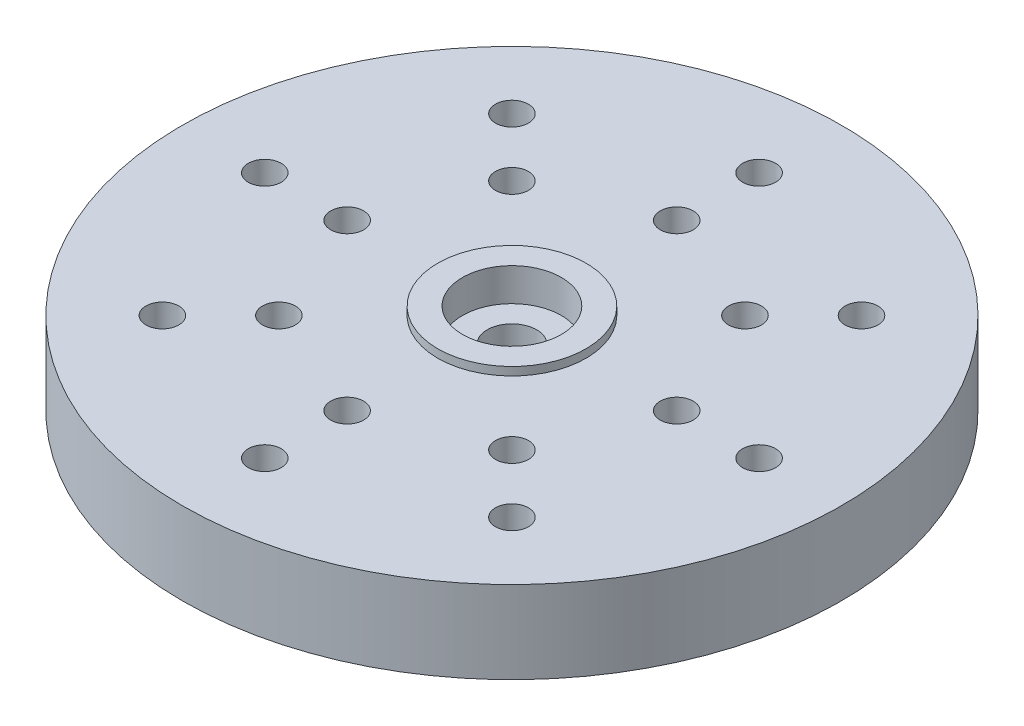
from build123d import *

# Parameters (mm, degrees)
SKETCH1_R                = 20
BOSS_EXTRUDE1_DEPTH      = 5
SKETCH3_R                = 1
CUT_EXTRUDE2_DEPTH       = 10
CIRPATTERN1_COUNT        = 8
SKETCH5_R                = 6
BOSS_EXTRUDE3_DEPTH      = 3
CUT_EXTRUDE5_DEPTH       = 30.393876913
BOSS_EXTRUDE4_DEPTH      = 0.5
BOSS_EXTRUDE4_DEPTH_BACK = 4.96
SKETCH4_R                = 4.5
SKETCH10_R               = 3
CUT_EXTRUDE6_DEPTH       = 2
SKETCH11_R               = 1.5
CUT_EXTRUDE7_DEPTH       = 30.021543722


with BuildPart() as part:
    # Sketch1 → Boss-Extrude1 (new body)
    with BuildSketch(Plane(origin=(0, 0, 0), x_dir=(1, 0, 0), z_dir=(0, 1, 0))):
        Circle(SKETCH1_R)
    extrude(amount=BOSS_EXTRUDE1_DEPTH)

    # Sketch3 → Cut-Extrude2 (cut)
    with BuildSketch(Plane(origin=(0, 5, 0), x_dir=(1, 0, 0), z_dir=(0, 1, 0))):
        with Locations((0, 15)):
            Circle(SKETCH3_R)
        with Locations((0, 10)):
            Circle(SKETCH3_R)
    cut_extrude2 = extrude(amount=-CUT_EXTRUDE2_DEPTH, mode=Mode.SUBTRACT)

    # CirPattern1: Cut-Extrude2 ×8 about axis
    cirpattern1_axis = Axis((0, 5, 0), (0, -1, 0))
    for i in range(1, CIRPATTERN1_COUNT):
        add(cut_extrude2.rotate(cirpattern1_axis, i * 360 / CIRPATTERN1_COUNT), mode=Mode.SUBTRACT)

    # Sketch5 → Boss-Extrude3 (add)
    with BuildSketch(Plane.XZ):
        Circle(SKETCH5_R)
    extrude(amount=BOSS_EXTRUDE3_DEPTH)

    # Sketch8 → Cut-Extrude5 (cut, through all)
    with BuildSketch(Plane.XZ.offset(3)):
        with BuildLine():
            Line((0.7, 3.684087404), (0, 3.05))
            Line((0, 3.05), (-0.7, 3.684087404))
            ThreePointArc((-0.7, 3.684087404), (-0.779668841, 3.668053503), (-0.858971523, 3.650296964))
            Line((-0.858971523, 3.650296964), (-1.240546761, 2.786313646))
            Line((-1.240546761, 2.786313646), (-2.137935164, 3.080865663))
            ThreePointArc((-2.137935164, 3.080865663), (-2.204194696, 3.033813729), (-2.269419066, 2.985337016))
            Line((-2.269419066, 2.985337016), (-2.266591718, 2.040848349))
            Line((-2.266591718, 2.040848349), (-3.206201915, 1.944934261))
            ThreePointArc((-3.206201915, 1.944934261), (-3.247595264, 1.875), (-3.287463436, 1.804185178))
            Line((-3.287463436, 1.804185178), (-2.900722375, 0.942501833))
            Line((-2.900722375, 0.942501833), (-3.720087228, 0.472706055))
            ThreePointArc((-3.720087228, 0.472706055), (-3.729457108, 0.391981737), (-3.737075512, 0.311073332))
            Line((-3.737075512, 0.311073332), (-3.033291781, -0.318811813))
            Line((-3.033291781, -0.318811813), (-3.590735663, -1.081257322))
            ThreePointArc((-3.590735663, -1.081257322), (-3.566461936, -1.158813729), (-3.540513282, -1.235825919))
            Line((-3.540513282, -1.235825919), (-2.641377482, -1.525))
            Line((-2.641377482, -1.525), (-2.840513282, -2.448261485))
            ThreePointArc((-2.840513282, -2.448261485), (-2.786793096, -2.509239774), (-2.73176414, -2.569039642))
            Line((-2.73176414, -2.569039642), (-1.792745019, -2.467501833))
            Line((-1.792745019, -2.467501833), (-1.599140348, -3.391938995))
            ThreePointArc((-1.599140348, -3.391938995), (-1.525262412, -3.425795466), (-1.450668162, -3.458043072))
            Line((-1.450668162, -3.458043072), (-0.634130657, -2.983350182))
            Line((-0.634130657, -2.983350182), (-0.081261521, -3.749119439))
            ThreePointArc((-0.081261521, -3.749119439), (0, -3.75), (0.081261521, -3.749119439))
            Line((0.081261521, -3.749119439), (0.634130657, -2.983350182))
            Line((0.634130657, -2.983350182), (1.450668162, -3.458043072))
            ThreePointArc((1.450668162, -3.458043072), (1.525262412, -3.425795466), (1.599140348, -3.391938995))
            Line((1.599140348, -3.391938995), (1.792745019, -2.467501833))
            Line((1.792745019, -2.467501833), (2.73176414, -2.569039642))
            ThreePointArc((2.73176414, -2.569039642), (2.786793096, -2.509239774), (2.840513282, -2.448261485))
            Line((2.840513282, -2.448261485), (2.641377482, -1.525))
            Line((2.641377482, -1.525), (3.540513282, -1.235825919))
            ThreePointArc((3.540513282, -1.235825919), (3.566461936, -1.158813729), (3.590735663, -1.081257322))
            Line((3.590735663, -1.081257322), (3.033291781, -0.318811813))
            Line((3.033291781, -0.318811813), (3.737075512, 0.311073332))
            ThreePointArc((3.737075512, 0.311073332), (3.729457108, 0.391981737), (3.720087228, 0.472706055))
            Line((3.720087228, 0.472706055), (2.900722375, 0.942501833))
            Line((2.900722375, 0.942501833), (3.287463436, 1.804185178))
            ThreePointArc((3.287463436, 1.804185178), (3.247595264, 1.875), (3.206201915, 1.944934261))
            Line((3.206201915, 1.944934261), (2.266591718, 2.040848349))
            Line((2.266591718, 2.040848349), (2.269419066, 2.985337016))
            ThreePointArc((2.269419066, 2.985337016), (2.204194696, 3.033813729), (2.137935164, 3.080865663))
            Line((2.137935164, 3.080865663), (1.240546761, 2.786313646))
            Line((1.240546761, 2.786313646), (0.858971523, 3.650296964))
            ThreePointArc((0.858971523, 3.650296964), (0.779668841, 3.668053503), (0.7, 3.684087404))
        make_face()
    extrude(amount=-CUT_EXTRUDE5_DEPTH, mode=Mode.SUBTRACT)

    # Sketch4 → Boss-Extrude4 (add, two sides: drawn at the far end of the back side and taken through both)
    with BuildSketch(Plane(origin=(0, 5, 0), x_dir=(1, 0, 0), z_dir=(0, 1, 0)).offset(-BOSS_EXTRUDE4_DEPTH_BACK)):
        Circle(SKETCH4_R)
    extrude(amount=BOSS_EXTRUDE4_DEPTH + BOSS_EXTRUDE4_DEPTH_BACK)

    # Sketch10 → Cut-Extrude6 (cut)
    with BuildSketch(Plane(origin=(0, 5.5, 0), x_dir=(1, 0, 0), z_dir=(0, 1, 0))):
        Circle(SKETCH10_R)
    extrude(amount=-CUT_EXTRUDE6_DEPTH, mode=Mode.SUBTRACT)

    # Sketch11 → Cut-Extrude7 (cut, through all)
    with BuildSketch(Plane(origin=(0, 3.5, 0), x_dir=(1, 0, 0), z_dir=(0, 1, 0))):
        Circle(SKETCH11_R)
    extrude(amount=-CUT_EXTRUDE7_DEPTH, mode=Mode.SUBTRACT)


solid = part.part
